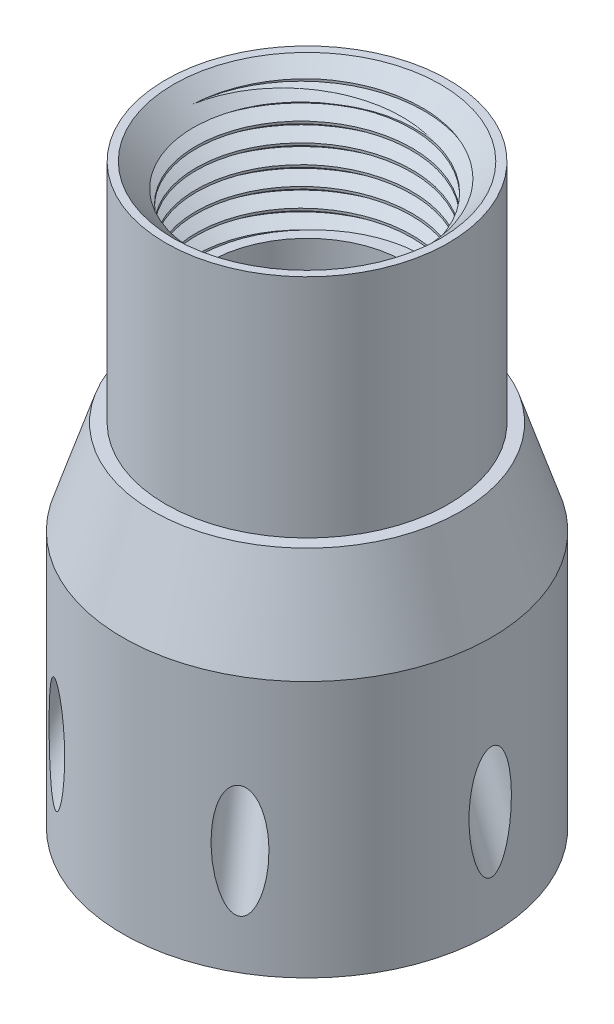
from build123d import *

# Parameters (mm, degrees)
CIRPATTERN1_COUNT            = 6
SKETCH8_R                    = 22.225
SKETCH8_R_2                  = 15.875
CUT_EXTRUDE1_DEPTH           = 25.4
SKETCH14_R                   = 13.4874
CUT_EXTRUDE2_DEPTH           = 15.24
SWEEP1_PITCH                 = 2.116666666
SKETCH17_R                   = 14.986
CUT_EXTRUDE5_DEPTH           = 7.62
CUT_EXTRUDE5_TAPER           = 45
CUT_EXTRUDE5_OTHER_WAY_DEPTH = 7.62
CHAMFER1_SIZE                = 15.24
CHAMFER1_SIZE2               = 4.951776171
SKETCH18_R                   = 10.9728
SKETCH18_R_2                 = 6.6675
BOSS_EXTRUDE1_DEPTH          = 20.32
F_3_4_16_TAPPED_HOLE3_D      = 17.4625
F_3_4_16_TAPPED_HOLE3_DEPTH  = 42.926
F_3_4_16_TAPPED_HOLE3_TIP    = 5.24626428
SKETCH21_W                   = 5.08
SKETCH21_H                   = 76.2


with BuildPart() as part:
    # Sketch1 → Revolve1 (revolve)
    with BuildSketch(Plane.XY, mode=Mode.PRIVATE) as revolve1_sk:
        Polygon((10.9728, 49.53), (10.9728, 0), (15.7353, 0), (15.7353, 1.3208), (17.8943, 1.3208), (17.8943, 0), (22.225, 0), (22.225, 64.77), (6.35, 64.77), (6.35, 49.53), align=None)
    revolve(revolve1_sk.sketch.rotate(Axis((0, 0, 0), (0, 1, 0)), 90), axis=Axis((0, 0, 0), (0, 1, 0)))

    # Sketch2 → Cut-Revolve3 (revolve, cut)
    with BuildSketch(Plane.XY, mode=Mode.PRIVATE) as cut_revolve3_sk:
        Polygon((9.743811587, 45.342031951), (7.535955034, 44.45), (36.080977452, -26.201409718), (38.288834006, -25.309377767), align=None)
    cut_revolve3 = revolve(cut_revolve3_sk.sketch.rotate(Axis((-2.803905559, 70.04205302, 0), (0.3746065934159062, -0.9271838545667898, 0)), 180), axis=Axis((-2.803905559, 70.04205302, 0), (0.3746065934159062, -0.9271838545667898, 0)), mode=Mode.SUBTRACT)

    # CirPattern1: Cut-Revolve3 ×6 about axis
    cirpattern1_axis = Axis((0, 93.345, 0), (0, -1, 0))
    for i in range(1, CIRPATTERN1_COUNT):
        add(cut_revolve3.rotate(cirpattern1_axis, i * 360 / CIRPATTERN1_COUNT), mode=Mode.SUBTRACT)

    # Sketch8 → Cut-Extrude1 (cut)
    with BuildSketch(Plane(origin=(0, 64.77, 0), x_dir=(1, 0, 0), z_dir=(0, 1, 0))):
        with Locations(Location((0, 0, 0), (0, 0, 90))):
            Circle(SKETCH8_R)
        with Locations(Location((0, 0, 0), (0, 0, 270))):
            Circle(SKETCH8_R_2, mode=Mode.SUBTRACT)
    extrude(amount=-CUT_EXTRUDE1_DEPTH, mode=Mode.SUBTRACT)

    # Sketch14 → Cut-Extrude2 (cut)
    with BuildSketch(Plane(origin=(0, 64.77, 0), x_dir=(1, 0, 0), z_dir=(0, 1, 0))):
        with Locations(Location((0, 0, 0), (0, 0, 270))):
            Circle(SKETCH14_R)
    extrude(amount=-CUT_EXTRUDE2_DEPTH, mode=Mode.SUBTRACT)

    # Sweep1: the profile of Sketch16 screwed along a right-hand helix of 7.9885 turns, 10 arcs to a turn; built about Z, then put on its axis
    sweep1_z = Axis((0, 0, 0), (0, 0, 1))
    sweep1_corners = [(12.112584671, 0, -0.79375), (12.112584671, 0, -1.058333333), (13.4874, 0, -1.852083333), (13.716535888, 0, 0.132291667)]
    with BuildLine(mode=Mode.PRIVATE) as sweep1_profile:
        Line(sweep1_corners[0], sweep1_corners[1])
        Line(sweep1_corners[1], sweep1_corners[2])
        Line(sweep1_corners[2], sweep1_corners[3])
        Line(sweep1_corners[3], sweep1_corners[0])
    sweep1_cap = Face(sweep1_profile.wire())
    sweep1_turn_angles = [0, 18, 36, 54, 72, 90, 108, 126, 144, 162, 180, 198, 216, 234, 252, 270, 288, 306, 324, 342, 360]
    sweep1_turn_weights = [1, 0.9510565162951535, 1, 0.9510565162951535, 1, 0.9510565162951535, 1, 0.9510565162951535, 1, 0.9510565162951535, 1, 0.9510565162951535, 1, 0.9510565162951535, 1, 0.9510565162951535, 1, 0.9510565162951535, 1, 0.9510565162951535, 1]
    sweep1_turn_rails = [Edge.make_bspline([Vector(p[0], p[1], 0).rotate(sweep1_z, sweep1_turn_angles[k]) / sweep1_turn_weights[k] + Vector(0, 0, p[2] + SWEEP1_PITCH * sweep1_turn_angles[k] / 360) for k in range(21)], [0, 0, 0, 1, 1, 2, 2, 3, 3, 4, 4, 5, 5, 6, 6, 7, 7, 8, 8, 9, 9, 10, 10, 10], 2, sweep1_turn_weights) for p in sweep1_corners]
    sweep1_turn_sides = [Face.make_surface_from_curves(sweep1_turn_rails[p[0]], sweep1_turn_rails[p[1]]) for p in [(0, 1), (1, 2), (2, 3), (3, 0)]]
    sweep1_last_angles = [2520, 2538, 2556, 2574, 2592, 2610, 2628, 2646, 2664, 2682, 2700, 2718, 2736, 2754, 2772, 2790, 2808, 2826, 2844, 2859.929993375, 2875.85998675]
    sweep1_last_weights = [1, 0.9510565162951535, 1, 0.9510565162951535, 1, 0.9510565162951535, 1, 0.9510565162951535, 1, 0.9510565162951535, 1, 0.9510565162951535, 1, 0.9510565162951535, 1, 0.9510565162951535, 1, 0.9510565162951535, 1, 0.9615977647456166, 1]
    sweep1_last_rails = [Edge.make_bspline([Vector(p[0], p[1], 0).rotate(sweep1_z, sweep1_last_angles[k]) / sweep1_last_weights[k] + Vector(0, 0, p[2] + SWEEP1_PITCH * sweep1_last_angles[k] / 360) for k in range(21)], [0, 0, 0, 1, 1, 2, 2, 3, 3, 4, 4, 5, 5, 6, 6, 7, 7, 8, 8, 9, 9, 10, 10, 10], 2, sweep1_last_weights) for p in sweep1_corners]
    sweep1_last_sides = [Face.make_surface_from_curves(sweep1_last_rails[p[0]], sweep1_last_rails[p[1]]) for p in [(0, 1), (1, 2), (2, 3), (3, 0)]]
    sweep1 = Plane(origin=(0, 49.53, 0), x_dir=(1, 0, 0), z_dir=(0, 1, 0)) * Solid(Shell([*[p.moved(Location((0, 0, SWEEP1_PITCH * i))) for i in range(7) for p in sweep1_turn_sides], *sweep1_last_sides, sweep1_cap, sweep1_cap.rotate(sweep1_z, 2875.85998675).moved(Location((0, 0, SWEEP1_PITCH * 2875.85998675 / 360)))]))
    add(sweep1)

    # Sketch17 → Cut-Extrude5 (cut)
    with BuildSketch(Plane(origin=(0, 64.77, 0), x_dir=(1, 0, 0), z_dir=(0, 1, 0))):
        Circle(SKETCH17_R)
    extrude(amount=-CUT_EXTRUDE5_DEPTH, taper=CUT_EXTRUDE5_TAPER, mode=Mode.SUBTRACT)

    # Sketch17 → Cut-Extrude5 other way (cut)
    with BuildSketch(Plane(origin=(0, 64.77, 0), x_dir=(1, 0, 0), z_dir=(0, 1, 0))):
        Circle(SKETCH17_R)
    extrude(amount=CUT_EXTRUDE5_OTHER_WAY_DEPTH, mode=Mode.SUBTRACT)

    # Chamfer1
    chamfer1_edges = [part.edges().sort_by_distance(p)[0] for p in [
        (0, 39.37, 22.225),
    ]]
    chamfer1_side = [part.faces().sort_by_distance(p)[0] for p in [
        (0, 19.685, 22.225),
    ]]
    chamfer(chamfer1_edges, length=CHAMFER1_SIZE, length2=CHAMFER1_SIZE2, reference=chamfer1_side[0])

    # Sketch18 → Boss-Extrude1 (add)
    with BuildSketch(Plane.XZ):
        with Locations(Location((0, 0, 0), (0, 0, 270))):
            Circle(SKETCH18_R)
        with Locations(Location((0, 0, 0), (0, 0, 270))):
            Circle(SKETCH18_R_2, mode=Mode.SUBTRACT)
    extrude(amount=-BOSS_EXTRUDE1_DEPTH)

    # 3/4-16 Tapped Hole3
    with Locations(Plane(origin=(0, 0, 0), x_dir=(-1, 0, 0), z_dir=(0, -1, 0))):
        with Locations((0, 0)):
            Hole(F_3_4_16_TAPPED_HOLE3_D / 2, depth=F_3_4_16_TAPPED_HOLE3_DEPTH)
            with Locations((0, 0, -(F_3_4_16_TAPPED_HOLE3_DEPTH + F_3_4_16_TAPPED_HOLE3_TIP / 2))):  # 118° drill point
                Cone(0, F_3_4_16_TAPPED_HOLE3_D / 2, F_3_4_16_TAPPED_HOLE3_TIP, mode=Mode.SUBTRACT)

    # Sketch21 → Cut-Revolve4 (revolve, cut)
    with BuildSketch(Plane.XY, mode=Mode.PRIVATE) as cut_revolve4_sk:
        with Locations((23.241, 38.1)):
            Rectangle(SKETCH21_W, SKETCH21_H)
    revolve(cut_revolve4_sk.sketch.rotate(Axis((0, 0, 0), (0, 1, 0)), 90), axis=Axis((0, 0, 0), (0, 1, 0)), mode=Mode.SUBTRACT)


solid = part.part
